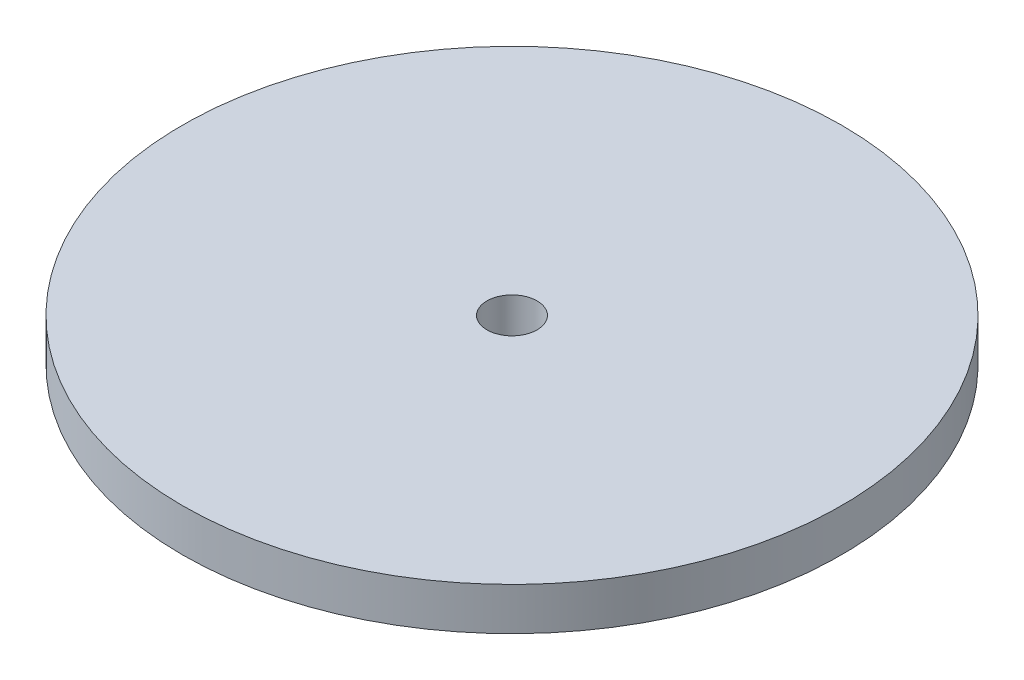
from build123d import *


with BuildPart() as part:
    # Sketch1 → Revolve1 (revolve)
    with BuildSketch(Plane.XY):
        Polygon((2.794, 0), (2.794, 3.3782), (1.3462, 3.3782), (1.3462, 5.6642), (17.6657, 5.6642), (17.6657, 3.3782), (4.3815, 3.3782), (4.3815, 0), align=None)
    revolve(axis=Axis((0, 0, 0), (0, 1, 0)))


solid = part.part
